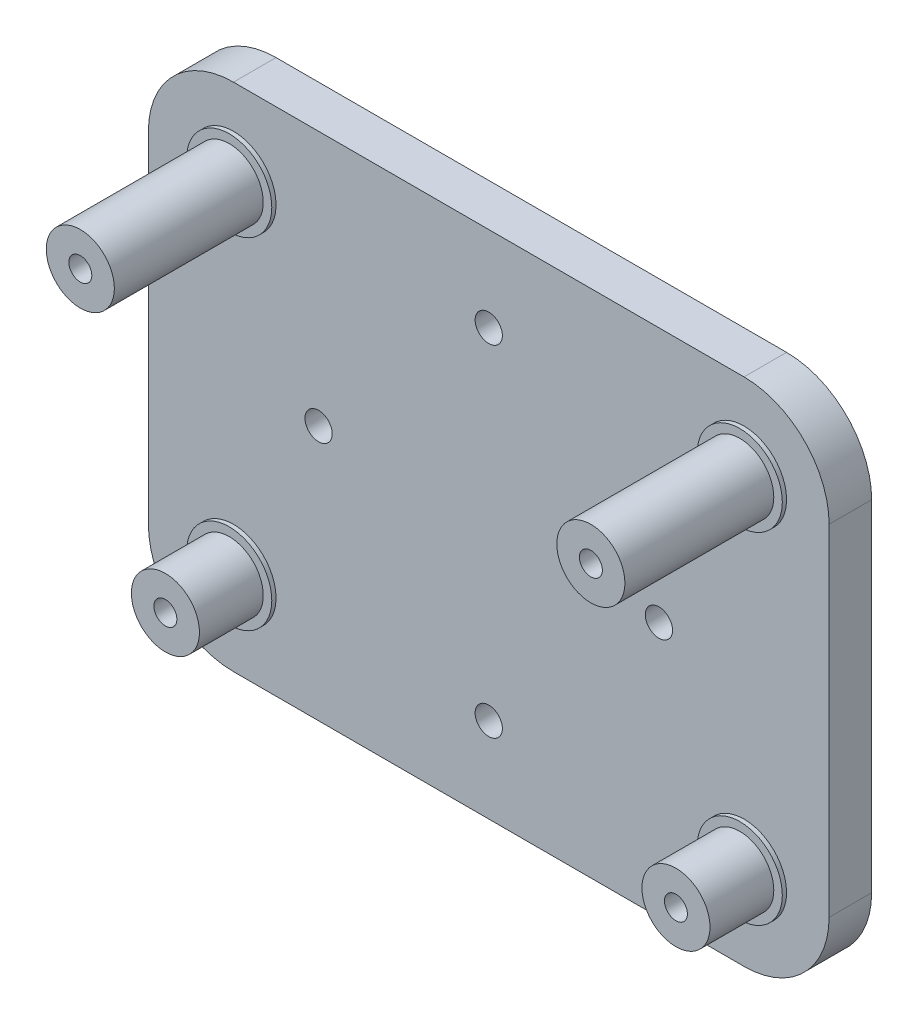
from build123d import *

# Parameters (mm, degrees)
SKETCH1_W               = 80
SKETCH1_H               = 60
BOSS_EXTRUDE1_DEPTH     = 5
SKETCH1_3_R             = 4
SKETCH1_3_R_2           = 1.35
BOSS_EXTRUDE2_DEPTH     = 8
SKETCH1_5_R             = 4
SKETCH1_5_R_2           = 1.35
BOSS_EXTRUDE4_DEPTH     = 18
SKETCH1_4_R             = 5
SKETCH1_4_R_2           = 4
BOSS_EXTRUDE3_DEPTH     = 0.5
CUT_EXTRUDE1_DEPTH      = 54.141321022
CUT_EXTRUDE1_DEPTH_BACK = 54.141321022
SKETCH1_6_R             = 1.6
FILLET1_R               = 10


with BuildPart() as part:
    # Sketch1 → Boss-Extrude1 (new body)
    with BuildSketch(Plane.XY):
        Rectangle(SKETCH1_W, SKETCH1_H)
    extrude(amount=-BOSS_EXTRUDE1_DEPTH)

    # Sketch1<3> → Boss-Extrude2 (add)
    # profile 1 of 2: a face of its own
    with BuildSketch(Plane.XY):
        with Locations((-30, -20)):
            Circle(SKETCH1_3_R)
        with Locations((-30, -20)):
            Circle(SKETCH1_3_R_2, mode=Mode.SUBTRACT)
    # profile 2 of 2: a face of its own
    with BuildSketch(Plane.XY):
        with Locations((30, -20)):
            Circle(SKETCH1_3_R)
        with Locations((30, -20)):
            Circle(SKETCH1_3_R_2, mode=Mode.SUBTRACT)
    extrude(amount=BOSS_EXTRUDE2_DEPTH)

    # Sketch1<5> → Boss-Extrude4 (add)
    # profile 1 of 2: a face of its own
    with BuildSketch(Plane.XY):
        with Locations((-30, 20)):
            Circle(SKETCH1_5_R)
        with Locations((-30, 20)):
            Circle(SKETCH1_5_R_2, mode=Mode.SUBTRACT)
    # profile 2 of 2: a face of its own
    with BuildSketch(Plane.XY):
        with Locations((30, 20)):
            Circle(SKETCH1_5_R)
        with Locations((30, 20)):
            Circle(SKETCH1_5_R_2, mode=Mode.SUBTRACT)
    extrude(amount=BOSS_EXTRUDE4_DEPTH)

    # Sketch1<4> → Boss-Extrude3 (add)
    # profile 1 of 4: a face of its own
    with BuildSketch(Plane.XY):
        with Locations((-30, 20)):
            Circle(SKETCH1_4_R)
        with Locations((-30, 20)):
            Circle(SKETCH1_4_R_2, mode=Mode.SUBTRACT)
    # profile 2 of 4: a face of its own
    with BuildSketch(Plane.XY):
        with Locations((30, 20)):
            Circle(SKETCH1_4_R)
        with Locations((30, 20)):
            Circle(SKETCH1_4_R_2, mode=Mode.SUBTRACT)
    # profile 3 of 4: a face of its own
    with BuildSketch(Plane.XY):
        with Locations((30, -20)):
            Circle(SKETCH1_4_R)
        with Locations((30, -20)):
            Circle(SKETCH1_4_R_2, mode=Mode.SUBTRACT)
    # profile 4 of 4: a face of its own
    with BuildSketch(Plane.XY):
        with Locations((-30, -20)):
            Circle(SKETCH1_4_R)
        with Locations((-30, -20)):
            Circle(SKETCH1_4_R_2, mode=Mode.SUBTRACT)
    extrude(amount=BOSS_EXTRUDE3_DEPTH)

    # Sketch1<6> → Cut-Extrude1 (cut, two sides: drawn at the far end of the back side and taken through both)
    with BuildSketch(Plane.XY.offset(-CUT_EXTRUDE1_DEPTH_BACK)):
        with Locations((-20, 0)):
            Circle(SKETCH1_6_R)
        with Locations((0, 20)):
            Circle(SKETCH1_6_R)
        with Locations((20, 0)):
            Circle(SKETCH1_6_R)
        with Locations((0, -20)):
            Circle(SKETCH1_6_R)
    extrude(amount=CUT_EXTRUDE1_DEPTH + CUT_EXTRUDE1_DEPTH_BACK, mode=Mode.SUBTRACT)

    # Fillet1
    fillet1_edges = [part.edges().sort_by_distance(p)[0] for p in [
        (40, 30, -2.5),
        (40, -30, -2.5),
        (-40, -30, -2.5),
        (-40, 30, -2.5),
    ]]
    fillet(fillet1_edges, radius=FILLET1_R)


solid = part.part
